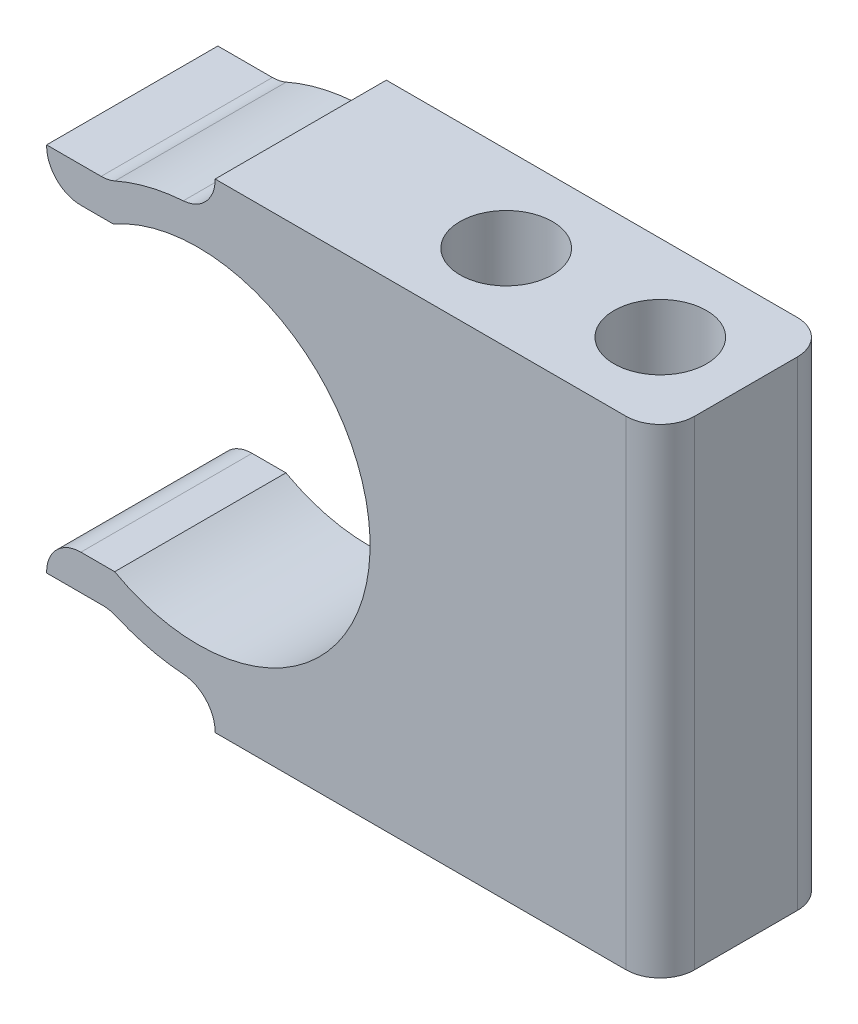
from build123d import *

# Parameters (mm, degrees)
BOSS_EXTRUDE1_DEPTH = 10
FILLET1_R           = 2
SKETCH2_R           = 2.7
CUT_EXTRUDE1_DEPTH  = 41.162171256


with BuildPart() as part:
    # Sketch1 → Boss-Extrude1 (new body)
    with BuildSketch(Plane.XY):
        with BuildLine():
            Line((1, -11.958260743), (1, -14))
            Line((1, -14), (9, -14))
            Line((9, -14), (27, -14))
            Line((27, -14), (27, 14))
            Line((27, 14), (5, 14))
            Line((5, 14), (1, 14))
            Line((1, 14), (1, 11.958260743))
            ThreePointArc((1, 11.958260743), (-2.185898684, 11.799230778), (-5.217338717, 10.806450699))
            Line((-5.217338717, 10.806450699), (-8.841229183, 10.806450699))
            Line((-8.841229183, 10.806450699), (-8.841229183, 8.75))
            Line((-8.841229183, 8.75), (-4.943682838, 8.75))
            ThreePointArc((-4.943682838, 8.75), (10.04990004, 0.04482392), (-4.865435329, -8.79375))
            Line((-4.865435329, -8.79375), (-8.841229183, -8.79375))
            Line((-8.841229183, -8.79375), (-8.841229183, -10.849241119))
            Line((-8.841229183, -10.849241119), (-5.127764341, -10.849241119))
            ThreePointArc((-5.127764341, -10.849241119), (-2.137075278, -11.808171292), (1, -11.958260743))
        make_face()
    extrude(amount=BOSS_EXTRUDE1_DEPTH)

    # Fillet1
    fillet1_edges = [part.edges().sort_by_distance(p)[0] for p in [
        (1, -11.958260743, 5),
        (1, 11.958260743, 5),
        (-5.127764341, -10.849241119, 5),
        (-8.841229183, 8.75, 5),
        (-8.841229183, -8.79375, 5),
        (-5.217338717, 10.806450699, 5),
        (27, 0, 0),
        (27, 0, 10),
    ]]
    fillet(fillet1_edges, radius=FILLET1_R)

    # Sketch2 → Cut-Extrude1 (cut, through all)
    with BuildSketch(Plane.XZ.offset(14)):
        with Locations((13, 5)):
            Circle(SKETCH2_R)
        with Locations((22, 5)):
            Circle(SKETCH2_R)
    extrude(amount=-CUT_EXTRUDE1_DEPTH, mode=Mode.SUBTRACT)


solid = part.part
